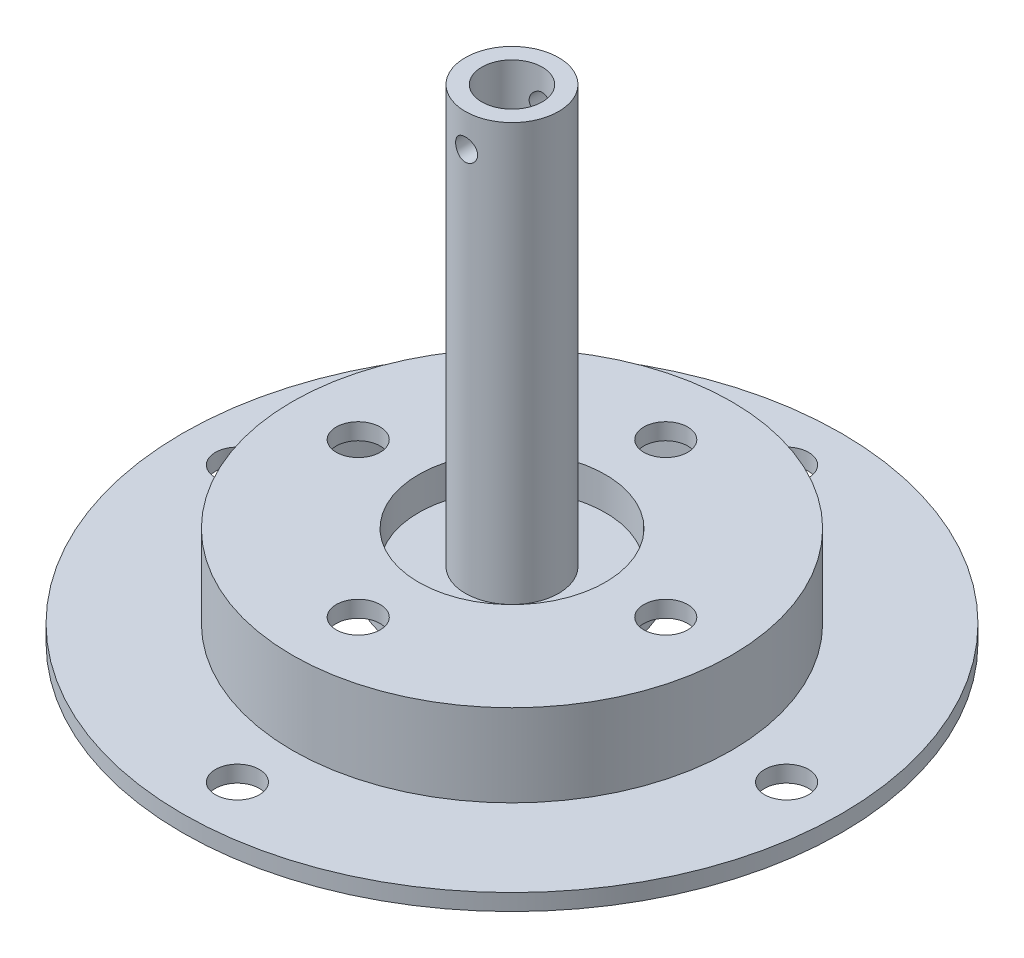
from build123d import *

# Parameters (mm, degrees)
SKETCH_1_R                      = 10
SKETCH_1_R_2                    = 2.75
EXTRUDE_1_DEPTH                 = 1.5
SKETCH_2_R                      = 10
SKETCH_2_R_2                    = 8.5
EXTRUDE_2_DEPTH                 = 3
SKETCH_3_R                      = 4.25
SKETCH_3_R_2                    = 2.75
EXTRUDE_3_DEPTH                 = 38
EXTRUDE_START                   = -1.5
SKETCH_4_R                      = 20
SKETCH_4_R_2                    = 8.5
SKETCH_4_R_3                    = 2
EXTRUDE_4_DEPTH                 = 1.5
EXTRUDE_START_2                 = 6
SKETCH_5_R                      = 20
SKETCH_5_R_2                    = 18.5
EXTRUDE_5_DEPTH                 = 6
CUT_EXTRUDE_2_REACH             = 50.582
SKETCH_7_R                      = 1
CUT_EXTRUDE_2_DIRECTION_2_REACH = 50.582
EXTRUDE_START_3                 = 1.5
SKETCH_8_R                      = 30
SKETCH_8_R_2                    = 18.5
SKETCH_8_R_3                    = 2
EXTRUDE_6_DEPTH                 = 1.5


with BuildPart() as part:
    # 草图1 → 凸台-拉伸1 (new body)
    with BuildSketch(Plane(origin=(0, 0, 0), x_dir=(1, 0, 0), z_dir=(0, 1, 0))):
        Circle(SKETCH_1_R)
        Circle(SKETCH_1_R_2, mode=Mode.SUBTRACT)
    extrude(amount=EXTRUDE_1_DEPTH)

    # 草图2 → 凸台-拉伸2 (add)
    with BuildSketch(Plane(origin=(0, 1.5, 0), x_dir=(1, 0, 0), z_dir=(0, 1, 0))):
        Circle(SKETCH_2_R)
        Circle(SKETCH_2_R_2, mode=Mode.SUBTRACT)
    extrude(amount=EXTRUDE_2_DEPTH)

    # 草图3 → 凸台-拉伸3 (add)
    with BuildSketch(Plane(origin=(0, 1.5, 0), x_dir=(1, 0, 0), z_dir=(0, 1, 0))):
        Circle(SKETCH_3_R)
        Circle(SKETCH_3_R_2, mode=Mode.SUBTRACT)
    extrude(amount=EXTRUDE_3_DEPTH)

    # 草图4 → 凸台-拉伸4 (add)
    with BuildSketch(Plane(origin=(0, 4.5, 0), x_dir=(1, 0, 0), z_dir=(0, 1, 0)).offset(EXTRUDE_START)):
        Circle(SKETCH_4_R)
        Circle(SKETCH_4_R_2, mode=Mode.SUBTRACT)
        with Locations((0, -14)):
            Circle(SKETCH_4_R_3, mode=Mode.SUBTRACT)
        with Locations((-14, 0)):
            Circle(SKETCH_4_R_3, mode=Mode.SUBTRACT)
        with Locations((14, 0)):
            Circle(SKETCH_4_R_3, mode=Mode.SUBTRACT)
        with Locations((0, 14)):
            Circle(SKETCH_4_R_3, mode=Mode.SUBTRACT)
    extrude(amount=EXTRUDE_4_DEPTH)

    # 草图5 → 凸台-拉伸5 (add)
    with BuildSketch(Plane.XZ.offset(-3).offset(EXTRUDE_START_2)):
        Circle(SKETCH_5_R)
        Circle(SKETCH_5_R_2, mode=Mode.SUBTRACT)
    extrude(amount=-EXTRUDE_5_DEPTH)

    # 草图7 → 切除-拉伸2 (cut, up to next)
    with BuildSketch(Plane.XY, mode=Mode.PRIVATE) as cut_extrude_2_sk1:
        with Locations((0, 36.5)):
            Circle(SKETCH_7_R)
    cut_extrude_2_tool1 = extrude(cut_extrude_2_sk1.sketch, amount=-CUT_EXTRUDE_2_REACH, mode=Mode.PRIVATE) & part.part
    add(cut_extrude_2_tool1.solids().sort_by_distance((0, 36.5, 0))[0], mode=Mode.SUBTRACT)

    # 草图7 → 切除-拉伸2 direction 2 (cut, up to next)
    with BuildSketch(Plane.XY, mode=Mode.PRIVATE) as cut_extrude_2_direction_2_sk1:
        with Locations((0, 36.5)):
            Circle(SKETCH_7_R)
    cut_extrude_2_direction_2_tool1 = extrude(cut_extrude_2_direction_2_sk1.sketch, amount=CUT_EXTRUDE_2_DIRECTION_2_REACH, mode=Mode.PRIVATE) & part.part
    add(cut_extrude_2_direction_2_tool1.solids().sort_by_distance((0, 36.5, 0))[0], mode=Mode.SUBTRACT)

    # 草图8 → 凸台-拉伸6 (add)
    with BuildSketch(Plane.XZ.offset(3).offset(EXTRUDE_START_3)):
        Circle(SKETCH_8_R)
        Circle(SKETCH_8_R_2, mode=Mode.SUBTRACT)
        with Locations((25, 0)):
            Circle(SKETCH_8_R_3, mode=Mode.SUBTRACT)
        with Locations((-25, 0)):
            Circle(SKETCH_8_R_3, mode=Mode.SUBTRACT)
        with Locations((0, -25)):
            Circle(SKETCH_8_R_3, mode=Mode.SUBTRACT)
        with Locations((0, 25)):
            Circle(SKETCH_8_R_3, mode=Mode.SUBTRACT)
    extrude(amount=-EXTRUDE_6_DEPTH)


solid = part.part
